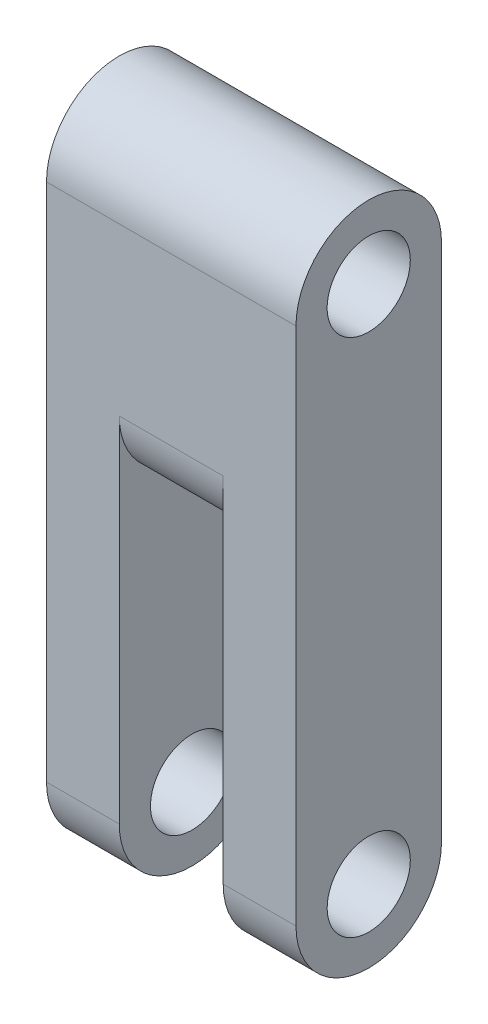
from build123d import *

# Parameters (mm, degrees)
EXTRUDE_1_DEPTH     = 12
SKETCH_2_R          = 2
CUT_EXTRUDE_2_DEPTH = 15
CUT_EXTRUDE_3_DEPTH = 5


with BuildPart() as part:
    # Эскиз1 → Бобышка-Вытянуть1 (new body)
    with BuildSketch(Plane(origin=(0, 0, 0), x_dir=(0, 0, -1), z_dir=(1, 0, 0))):
        with BuildLine():
            Line((0, 0), (0, 25))
            ThreePointArc((0, 25), (3.5, 28.5), (7, 25))
            Line((7, 25), (7, 0))
            ThreePointArc((7, 0), (3.5, -3.5), (0, 0))
        make_face()
    extrude(amount=EXTRUDE_1_DEPTH)

    # Эскиз2 → Вырез-Вытянуть2 (cut)
    with BuildSketch(Plane(origin=(12, 0, 0), x_dir=(0, 0, -1), z_dir=(1, 0, 0))):
        with Locations((3.5, 25)):
            Circle(SKETCH_2_R)
        with Locations((3.5, 0)):
            Circle(SKETCH_2_R)
    extrude(amount=-CUT_EXTRUDE_2_DEPTH, mode=Mode.SUBTRACT)

    # Эскиз3 → Вырез-Вытянуть3 (cut)
    with BuildSketch(Plane(origin=(3.5, 0, 0), x_dir=(0, 0, -1), z_dir=(1, 0, 0))):
        with BuildLine():
            Line((-5.973465406, 17), (-5.973465406, -6.207481123))
            Line((-5.973465406, -6.207481123), (11.9268428, -6.207481123))
            Line((11.9268428, -6.207481123), (11.9268428, 17))
            Line((11.9268428, 17), (7, 17))
            ThreePointArc((7, 17), (3.5, 13.5), (0, 17))
            Line((0, 17), (-5.973465406, 17))
        make_face()
    extrude(amount=CUT_EXTRUDE_3_DEPTH, mode=Mode.SUBTRACT)


solid = part.part
